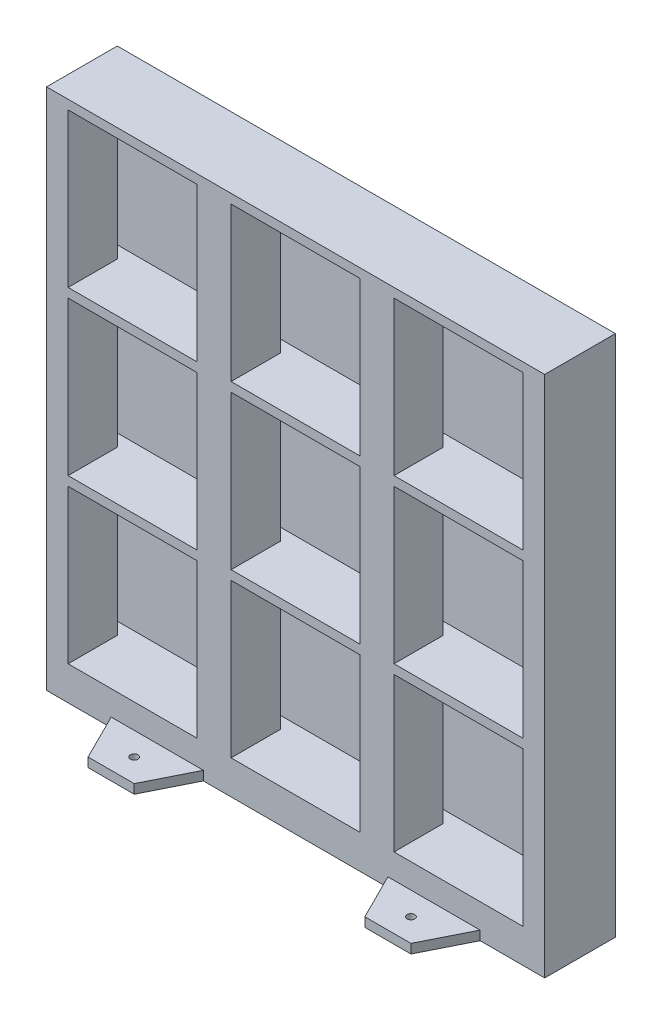
from build123d import *

# Parameters (mm, degrees)
SKETCH1_W                 = 162
SKETCH1_H                 = 162
SKETCH1_W_2               = 50
SKETCH1_H_2               = 50
BOSS_EXTRUDE1_DEPTH       = 23
SKETCH1_2_W               = 162
SKETCH1_2_H               = 162
BOSS_EXTRUDE2_DEPTH       = 3
SKETCH2_W                 = 4
SKETCH2_H                 = 50
BOSS_EXTRUDE3_DEPTH       = 16
LPATTERN1_COUNT           = 3
LPATTERN1_PITCH           = 53
LPATTERN2_COPY_1_SKETCH_W = 4
LPATTERN2_COPY_1_SKETCH_H = 50
LPATTERN2_COPY_1_DEPTH    = 16
LPATTERN2_COPY_2_SKETCH_W = 4
LPATTERN2_COPY_2_SKETCH_H = 50
LPATTERN2_COPY_2_DEPTH    = 16
LPATTERN2_COPY_3_SKETCH_W = 4
LPATTERN2_COPY_3_SKETCH_H = 50
LPATTERN2_COPY_3_DEPTH    = 16
LPATTERN2_COPY_4_SKETCH_W = 4
LPATTERN2_COPY_4_SKETCH_H = 50
LPATTERN2_COPY_4_DEPTH    = 16
LPATTERN2_COPY_5_SKETCH_W = 4
LPATTERN2_COPY_5_SKETCH_H = 50
LPATTERN2_COPY_5_DEPTH    = 16
LPATTERN2_COPY_6_SKETCH_W = 4
LPATTERN2_COPY_6_SKETCH_H = 50
LPATTERN2_COPY_6_DEPTH    = 16
SKETCH5_W                 = 162
SKETCH5_H                 = 23
BOSS_EXTRUDE5_DEPTH       = 8
BOSS_EXTRUDE4_START       = 8
SKETCH3_R                 = 1.25
BOSS_EXTRUDE4_DEPTH       = 3


with BuildPart() as part:
    # Sketch1 → Boss-Extrude1 (new body)
    with BuildSketch(Plane.XY):
        with Locations((2.220930233, -28.593023256)):
            Rectangle(SKETCH1_W, SKETCH1_H)
        with Locations((-50.779069767, 24.406976744)):
            Rectangle(SKETCH1_W_2, SKETCH1_H_2, mode=Mode.SUBTRACT)
        with Locations((2.220930233, 24.406976744)):
            Rectangle(SKETCH1_W_2, SKETCH1_H_2, mode=Mode.SUBTRACT)
        with Locations((55.220930233, 24.406976744)):
            Rectangle(SKETCH1_W_2, SKETCH1_H_2, mode=Mode.SUBTRACT)
        with Locations((-50.779069767, -28.593023256)):
            Rectangle(SKETCH1_W_2, SKETCH1_H_2, mode=Mode.SUBTRACT)
        with Locations((2.220930233, -28.593023256)):
            Rectangle(SKETCH1_W_2, SKETCH1_H_2, mode=Mode.SUBTRACT)
        with Locations((55.220930233, -28.593023256)):
            Rectangle(SKETCH1_W_2, SKETCH1_H_2, mode=Mode.SUBTRACT)
        with Locations((-50.779069767, -81.593023256)):
            Rectangle(SKETCH1_W_2, SKETCH1_H_2, mode=Mode.SUBTRACT)
        with Locations((2.220930233, -81.593023256)):
            Rectangle(SKETCH1_W_2, SKETCH1_H_2, mode=Mode.SUBTRACT)
        with Locations((55.220930233, -81.593023256)):
            Rectangle(SKETCH1_W_2, SKETCH1_H_2, mode=Mode.SUBTRACT)
    extrude(amount=BOSS_EXTRUDE1_DEPTH)

    # Sketch1<2> → Boss-Extrude2 (add)
    with BuildSketch(Plane.XY):
        with Locations((2.220930233, -28.593023256)):
            Rectangle(SKETCH1_2_W, SKETCH1_2_H)
    extrude(amount=BOSS_EXTRUDE2_DEPTH)

    # Sketch2 → Boss-Extrude3 (add)
    with BuildSketch(Plane.XY.offset(23)):
        with Locations((-27.779069767, 24.406976744)):
            Rectangle(SKETCH2_W, SKETCH2_H)
        with Locations((-73.779069767, 24.406976744)):
            Rectangle(SKETCH2_W, SKETCH2_H)
    boss_extrude3 = extrude(amount=-BOSS_EXTRUDE3_DEPTH)

    # LPattern1: Boss-Extrude3 ×3
    with Locations(*[(i * LPATTERN1_PITCH, 0, 0) for i in range(1, LPATTERN1_COUNT)]):
        add(boss_extrude3)

    # LPattern2 copy 1 sketch → LPattern2 copy 1 (add)
    with BuildSketch(Plane(origin=(53, -53, 23), x_dir=(1, 0, 0), z_dir=(0, 0, 1))):
        with Locations((-27.779069767, 24.406976744)):
            Rectangle(LPATTERN2_COPY_1_SKETCH_W, LPATTERN2_COPY_1_SKETCH_H)
        with Locations((-73.779069767, 24.406976744)):
            Rectangle(LPATTERN2_COPY_1_SKETCH_W, LPATTERN2_COPY_1_SKETCH_H)
    extrude(amount=-LPATTERN2_COPY_1_DEPTH)

    # LPattern2 copy 2 sketch → LPattern2 copy 2 (add)
    with BuildSketch(Plane(origin=(53, -106, 23), x_dir=(1, 0, 0), z_dir=(0, 0, 1))):
        with Locations((-27.779069767, 24.406976744)):
            Rectangle(LPATTERN2_COPY_2_SKETCH_W, LPATTERN2_COPY_2_SKETCH_H)
        with Locations((-73.779069767, 24.406976744)):
            Rectangle(LPATTERN2_COPY_2_SKETCH_W, LPATTERN2_COPY_2_SKETCH_H)
    extrude(amount=-LPATTERN2_COPY_2_DEPTH)

    # LPattern2 copy 3 sketch → LPattern2 copy 3 (add)
    with BuildSketch(Plane(origin=(106, -53, 23), x_dir=(1, 0, 0), z_dir=(0, 0, 1))):
        with Locations((-27.779069767, 24.406976744)):
            Rectangle(LPATTERN2_COPY_3_SKETCH_W, LPATTERN2_COPY_3_SKETCH_H)
        with Locations((-73.779069767, 24.406976744)):
            Rectangle(LPATTERN2_COPY_3_SKETCH_W, LPATTERN2_COPY_3_SKETCH_H)
    extrude(amount=-LPATTERN2_COPY_3_DEPTH)

    # LPattern2 copy 4 sketch → LPattern2 copy 4 (add)
    with BuildSketch(Plane(origin=(106, -106, 23), x_dir=(1, 0, 0), z_dir=(0, 0, 1))):
        with Locations((-27.779069767, 24.406976744)):
            Rectangle(LPATTERN2_COPY_4_SKETCH_W, LPATTERN2_COPY_4_SKETCH_H)
        with Locations((-73.779069767, 24.406976744)):
            Rectangle(LPATTERN2_COPY_4_SKETCH_W, LPATTERN2_COPY_4_SKETCH_H)
    extrude(amount=-LPATTERN2_COPY_4_DEPTH)

    # LPattern2 copy 5 sketch → LPattern2 copy 5 (add)
    with BuildSketch(Plane(origin=(0, -53, 23), x_dir=(1, 0, 0), z_dir=(0, 0, 1))):
        with Locations((-27.779069767, 24.406976744)):
            Rectangle(LPATTERN2_COPY_5_SKETCH_W, LPATTERN2_COPY_5_SKETCH_H)
        with Locations((-73.779069767, 24.406976744)):
            Rectangle(LPATTERN2_COPY_5_SKETCH_W, LPATTERN2_COPY_5_SKETCH_H)
    extrude(amount=-LPATTERN2_COPY_5_DEPTH)

    # LPattern2 copy 6 sketch → LPattern2 copy 6 (add)
    with BuildSketch(Plane(origin=(0, -106, 23), x_dir=(1, 0, 0), z_dir=(0, 0, 1))):
        with Locations((-27.779069767, 24.406976744)):
            Rectangle(LPATTERN2_COPY_6_SKETCH_W, LPATTERN2_COPY_6_SKETCH_H)
        with Locations((-73.779069767, 24.406976744)):
            Rectangle(LPATTERN2_COPY_6_SKETCH_W, LPATTERN2_COPY_6_SKETCH_H)
    extrude(amount=-LPATTERN2_COPY_6_DEPTH)

    # Sketch5 → Boss-Extrude5 (add)
    with BuildSketch(Plane.XZ.offset(109.593023256)):
        with Locations((2.220930233, 11.5)):
            Rectangle(SKETCH5_W, SKETCH5_H)
    extrude(amount=BOSS_EXTRUDE5_DEPTH)

    # Sketch3 → Boss-Extrude4 (add)
    # profile 1 of 2: a face of its own
    with BuildSketch(Plane.XZ.offset(109.593023256).offset(BOSS_EXTRUDE4_START)):
        Polygon((-35.279069767, 38), (-50.279069767, 38), (-57.779069767, 23), (-27.779069767, 23), align=None)
        with Locations((-42.779069767, 30.5)):
            Circle(SKETCH3_R, mode=Mode.SUBTRACT)
    # profile 2 of 2: a face of its own
    with BuildSketch(Plane.XZ.offset(109.593023256).offset(BOSS_EXTRUDE4_START)):
        Polygon((62.220930233, 23), (54.720930233, 38), (39.720930233, 38), (32.220930233, 23), align=None)
        with Locations((47.220930233, 30.5)):
            Circle(SKETCH3_R, mode=Mode.SUBTRACT)
    extrude(amount=-BOSS_EXTRUDE4_DEPTH)


solid = part.part
